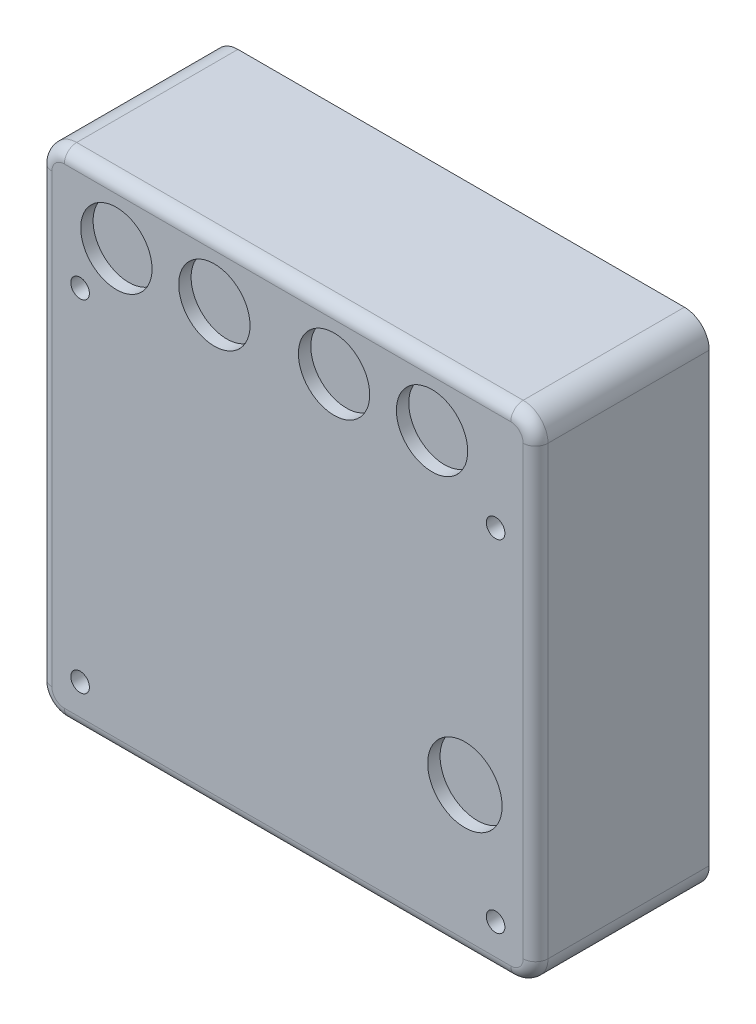
from build123d import *

# Parameters (mm, degrees)
SKETCH1_W           = 80
SKETCH1_H           = 80
BOSS_EXTRUDE1_DEPTH = 14
FILLET1_R           = 2
FILLET2_R           = 4
SKETCH2_R           = 5.75
CUT_EXTRUDE1_DEPTH  = 2
SKETCH3_R           = 1.5
CUT_EXTRUDE2_DEPTH  = 12
SKETCH6_R           = 6
CUT_EXTRUDE3_DEPTH  = 2
SKETCH7_W           = 33.5
SKETCH7_H           = 42
BOSS_EXTRUDE2_DEPTH = 2.5


with BuildPart() as part:
    # Sketch1 → Boss-Extrude1 (new, symmetric)
    with BuildSketch(Plane.XY):
        Rectangle(SKETCH1_W, SKETCH1_H)
    extrude(amount=BOSS_EXTRUDE1_DEPTH, both=True)

    # Fillet1
    fillet1_edges = [part.edges().sort_by_distance(p)[0] for p in [
        (-40, 0, 14),
        (0, -40, 14),
        (40, 0, 14),
        (0, 40, 14),
    ]]
    fillet(fillet1_edges, radius=FILLET1_R)

    # Fillet2
    # the kernel refuses this fillet: 4 mm, written as the material it takes off along each edge
    with BuildSketch(Plane(origin=(-36, -36, 14), x_dir=(-1, 0, 0), z_dir=(0, 1, 0))) as fillet2_piece_1:
        with BuildLine():
            CenterArc((2, -2), 2, 0, 90)
            Line((4, -2), (4, 0))
            Line((4, 0), (2, 0))
        make_face()
    revolve(axis=Axis((-36, -36, 14), (0, 0, 1)), revolution_arc=90, mode=Mode.SUBTRACT)
    with BuildSketch(Plane(origin=(-36, 36, 14), x_dir=(0, 1, 0), z_dir=(1, 0, 0))) as fillet2_piece_2:
        with BuildLine():
            CenterArc((2, -2), 2, 0, 90)
            Line((4, -2), (4, 0))
            Line((4, 0), (2, 0))
        make_face()
    revolve(axis=Axis((-36, 36, 14), (0, 0, 1)), revolution_arc=90, mode=Mode.SUBTRACT)
    with BuildSketch(Plane(origin=(36, -36, 14), x_dir=(0, -1, 0), z_dir=(-1, 0, 0))) as fillet2_piece_3:
        with BuildLine():
            CenterArc((2, -2), 2, 0, 90)
            Line((4, -2), (4, 0))
            Line((4, 0), (2, 0))
        make_face()
    revolve(axis=Axis((36, -36, 14), (0, 0, 1)), revolution_arc=90, mode=Mode.SUBTRACT)
    with BuildSketch(Plane(origin=(36, 36, 14), x_dir=(1, 0, 0), z_dir=(0, -1, 0))) as fillet2_piece_4:
        with BuildLine():
            CenterArc((2, -2), 2, 0, 90)
            Line((4, -2), (4, 0))
            Line((4, 0), (2, 0))
        make_face()
    revolve(axis=Axis((36, 36, 14), (0, 0, 1)), revolution_arc=90, mode=Mode.SUBTRACT)
    with BuildSketch(Plane(origin=(40, 40, 14), x_dir=(-1, 0, 0), z_dir=(0, 0, -1)), Plane(origin=(40, -40, 14), x_dir=(0, 1, 0), z_dir=(0, 0, -1)), Plane(origin=(-40, -40, -24), x_dir=(0, 1, 0), z_dir=(0, 0, 1)), Plane(origin=(-40, 40, -24), x_dir=(1, 0, 0), z_dir=(0, 0, 1))) as fillet2_piece_5:
        with BuildLine():
            CenterArc((FILLET2_R, -FILLET2_R), FILLET2_R, 90, 90)
            Line((0, -FILLET2_R), (0, 0))
            Line((0, 0), (FILLET2_R, 0))
        make_face()
    extrude(amount=38, mode=Mode.SUBTRACT)

    # Sketch2 → Cut-Extrude1 (cut)
    with BuildSketch(Plane.XY.offset(14)):
        with Locations((-27.6, 30.4)):
            Circle(SKETCH2_R)
        with Locations((-11.8, 30.4)):
            Circle(SKETCH2_R)
        with Locations((7.5, 30.4)):
            Circle(SKETCH2_R)
        with Locations((23.3, 30.4)):
            Circle(SKETCH2_R)
    extrude(amount=-CUT_EXTRUDE1_DEPTH, mode=Mode.SUBTRACT)

    # Sketch3 → Cut-Extrude2 (cut)
    with BuildSketch(Plane.XY.offset(14)):
        with Locations((-33.45, 21.95)):
            Circle(SKETCH3_R)
        with Locations((33.55, 21.95)):
            Circle(SKETCH3_R)
        with Locations((-33.45, -33.05)):
            Circle(SKETCH3_R)
        with Locations((33.55, -33.05)):
            Circle(SKETCH3_R)
    extrude(amount=-CUT_EXTRUDE2_DEPTH, mode=Mode.SUBTRACT)

    # Sketch6 → Cut-Extrude3 (cut)
    with BuildSketch(Plane.XY.offset(14)):
        with Locations((28.6, -16.4)):
            Circle(SKETCH6_R)
    extrude(amount=-CUT_EXTRUDE3_DEPTH, mode=Mode.SUBTRACT)

    # Sketch7 → Boss-Extrude2 (add)
    with BuildSketch(Plane(origin=(0, 0, -14), x_dir=(-1, 0, 0), z_dir=(0, 0, -1))):
        Rectangle(SKETCH7_W, SKETCH7_H)
    extrude(amount=BOSS_EXTRUDE2_DEPTH)


solid = part.part
